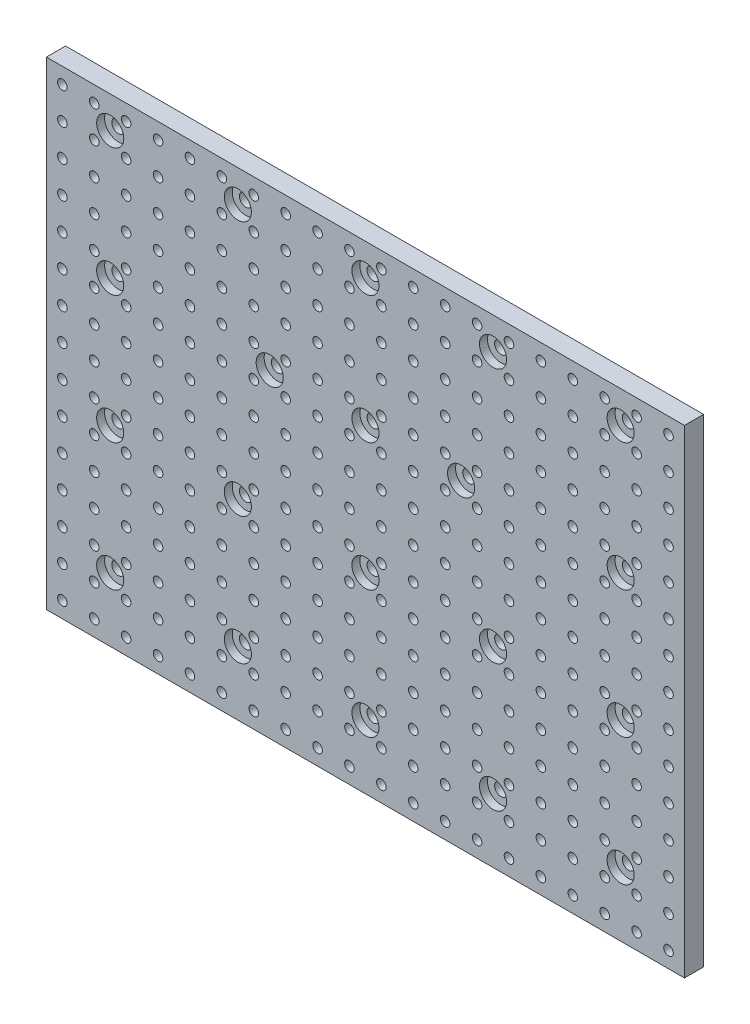
from build123d import *

# Parameters (mm, degrees)
SKETCH1_W           = 400
SKETCH1_H           = 300
BOSS_EXTRUDE1_DEPTH = 12
SKETCH5_R           = 3
CUT_EXTRUDE1_DEPTH  = 251.287834303
SKETCH6_R           = 4
CUT_EXTRUDE2_DEPTH  = 251.287834303
SKETCH7_R           = 8.5
CUT_EXTRUDE3_DEPTH  = 5


with BuildPart() as part:
    # Sketch1 → Boss-Extrude1 (new body)
    with BuildSketch(Plane.XY):
        Rectangle(SKETCH1_W, SKETCH1_H)
    extrude(amount=BOSS_EXTRUDE1_DEPTH)

    # Sketch5 → Cut-Extrude1 (cut, through all)
    with BuildSketch(Plane.XY.offset(12)):
        with Locations((-190, 140)):
            Circle(SKETCH5_R)
        with Locations((-170, 140)):
            Circle(SKETCH5_R)
        with Locations((-150, 140)):
            Circle(SKETCH5_R)
        with Locations((-130, 140)):
            Circle(SKETCH5_R)
        with Locations((-110, 140)):
            Circle(SKETCH5_R)
        with Locations((-90, 140)):
            Circle(SKETCH5_R)
        with Locations((-70, 140)):
            Circle(SKETCH5_R)
        with Locations((-50, 140)):
            Circle(SKETCH5_R)
        with Locations((-30, 140)):
            Circle(SKETCH5_R)
        with Locations((-10, 140)):
            Circle(SKETCH5_R)
        with Locations((10, 140)):
            Circle(SKETCH5_R)
        with Locations((30, 140)):
            Circle(SKETCH5_R)
        with Locations((50, 140)):
            Circle(SKETCH5_R)
        with Locations((70, 140)):
            Circle(SKETCH5_R)
        with Locations((90, 140)):
            Circle(SKETCH5_R)
        with Locations((110, 140)):
            Circle(SKETCH5_R)
        with Locations((130, 140)):
            Circle(SKETCH5_R)
        with Locations((150, 140)):
            Circle(SKETCH5_R)
        with Locations((170, 140)):
            Circle(SKETCH5_R)
        with Locations((190, 140)):
            Circle(SKETCH5_R)
        with Locations((-170, 120)):
            Circle(SKETCH5_R)
        with Locations((-150, 120)):
            Circle(SKETCH5_R)
        with Locations((-130, 120)):
            Circle(SKETCH5_R)
        with Locations((-110, 120)):
            Circle(SKETCH5_R)
        with Locations((-90, 120)):
            Circle(SKETCH5_R)
        with Locations((-70, 120)):
            Circle(SKETCH5_R)
        with Locations((-50, 120)):
            Circle(SKETCH5_R)
        with Locations((-30, 120)):
            Circle(SKETCH5_R)
        with Locations((-10, 120)):
            Circle(SKETCH5_R)
        with Locations((10, 120)):
            Circle(SKETCH5_R)
        with Locations((30, 120)):
            Circle(SKETCH5_R)
        with Locations((50, 120)):
            Circle(SKETCH5_R)
        with Locations((70, 120)):
            Circle(SKETCH5_R)
        with Locations((90, 120)):
            Circle(SKETCH5_R)
        with Locations((110, 120)):
            Circle(SKETCH5_R)
        with Locations((130, 120)):
            Circle(SKETCH5_R)
        with Locations((150, 120)):
            Circle(SKETCH5_R)
        with Locations((170, 120)):
            Circle(SKETCH5_R)
        with Locations((190, 120)):
            Circle(SKETCH5_R)
        with Locations((-170, 100)):
            Circle(SKETCH5_R)
        with Locations((-150, 100)):
            Circle(SKETCH5_R)
        with Locations((-130, 100)):
            Circle(SKETCH5_R)
        with Locations((-110, 100)):
            Circle(SKETCH5_R)
        with Locations((-90, 100)):
            Circle(SKETCH5_R)
        with Locations((-70, 100)):
            Circle(SKETCH5_R)
        with Locations((-50, 100)):
            Circle(SKETCH5_R)
        with Locations((-30, 100)):
            Circle(SKETCH5_R)
        with Locations((-10, 100)):
            Circle(SKETCH5_R)
        with Locations((10, 100)):
            Circle(SKETCH5_R)
        with Locations((30, 100)):
            Circle(SKETCH5_R)
        with Locations((50, 100)):
            Circle(SKETCH5_R)
        with Locations((70, 100)):
            Circle(SKETCH5_R)
        with Locations((90, 100)):
            Circle(SKETCH5_R)
        with Locations((110, 100)):
            Circle(SKETCH5_R)
        with Locations((130, 100)):
            Circle(SKETCH5_R)
        with Locations((150, 100)):
            Circle(SKETCH5_R)
        with Locations((170, 100)):
            Circle(SKETCH5_R)
        with Locations((190, 100)):
            Circle(SKETCH5_R)
        with Locations((-170, 80)):
            Circle(SKETCH5_R)
        with Locations((-150, 80)):
            Circle(SKETCH5_R)
        with Locations((-130, 80)):
            Circle(SKETCH5_R)
        with Locations((-110, 80)):
            Circle(SKETCH5_R)
        with Locations((-90, 80)):
            Circle(SKETCH5_R)
        with Locations((-70, 80)):
            Circle(SKETCH5_R)
        with Locations((-50, 80)):
            Circle(SKETCH5_R)
        with Locations((-30, 80)):
            Circle(SKETCH5_R)
        with Locations((-10, 80)):
            Circle(SKETCH5_R)
        with Locations((10, 80)):
            Circle(SKETCH5_R)
        with Locations((30, 80)):
            Circle(SKETCH5_R)
        with Locations((50, 80)):
            Circle(SKETCH5_R)
        with Locations((70, 80)):
            Circle(SKETCH5_R)
        with Locations((90, 80)):
            Circle(SKETCH5_R)
        with Locations((110, 80)):
            Circle(SKETCH5_R)
        with Locations((130, 80)):
            Circle(SKETCH5_R)
        with Locations((150, 80)):
            Circle(SKETCH5_R)
        with Locations((170, 80)):
            Circle(SKETCH5_R)
        with Locations((190, 80)):
            Circle(SKETCH5_R)
        with Locations((-170, 60)):
            Circle(SKETCH5_R)
        with Locations((-150, 60)):
            Circle(SKETCH5_R)
        with Locations((-130, 60)):
            Circle(SKETCH5_R)
        with Locations((-110, 60)):
            Circle(SKETCH5_R)
        with Locations((-90, 60)):
            Circle(SKETCH5_R)
        with Locations((-70, 60)):
            Circle(SKETCH5_R)
        with Locations((-50, 60)):
            Circle(SKETCH5_R)
        with Locations((-30, 60)):
            Circle(SKETCH5_R)
        with Locations((-10, 60)):
            Circle(SKETCH5_R)
        with Locations((10, 60)):
            Circle(SKETCH5_R)
        with Locations((30, 60)):
            Circle(SKETCH5_R)
        with Locations((50, 60)):
            Circle(SKETCH5_R)
        with Locations((70, 60)):
            Circle(SKETCH5_R)
        with Locations((90, 60)):
            Circle(SKETCH5_R)
        with Locations((110, 60)):
            Circle(SKETCH5_R)
        with Locations((130, 60)):
            Circle(SKETCH5_R)
        with Locations((150, 60)):
            Circle(SKETCH5_R)
        with Locations((170, 60)):
            Circle(SKETCH5_R)
        with Locations((190, 60)):
            Circle(SKETCH5_R)
        with Locations((-170, 40)):
            Circle(SKETCH5_R)
        with Locations((-150, 40)):
            Circle(SKETCH5_R)
        with Locations((-130, 40)):
            Circle(SKETCH5_R)
        with Locations((-110, 40)):
            Circle(SKETCH5_R)
        with Locations((-90, 40)):
            Circle(SKETCH5_R)
        with Locations((-70, 40)):
            Circle(SKETCH5_R)
        with Locations((-50, 40)):
            Circle(SKETCH5_R)
        with Locations((-30, 40)):
            Circle(SKETCH5_R)
        with Locations((-10, 40)):
            Circle(SKETCH5_R)
        with Locations((10, 40)):
            Circle(SKETCH5_R)
        with Locations((30, 40)):
            Circle(SKETCH5_R)
        with Locations((50, 40)):
            Circle(SKETCH5_R)
        with Locations((70, 40)):
            Circle(SKETCH5_R)
        with Locations((90, 40)):
            Circle(SKETCH5_R)
        with Locations((110, 40)):
            Circle(SKETCH5_R)
        with Locations((130, 40)):
            Circle(SKETCH5_R)
        with Locations((150, 40)):
            Circle(SKETCH5_R)
        with Locations((170, 40)):
            Circle(SKETCH5_R)
        with Locations((190, 40)):
            Circle(SKETCH5_R)
        with Locations((-170, 20)):
            Circle(SKETCH5_R)
        with Locations((-150, 20)):
            Circle(SKETCH5_R)
        with Locations((-130, 20)):
            Circle(SKETCH5_R)
        with Locations((-110, 20)):
            Circle(SKETCH5_R)
        with Locations((-90, 20)):
            Circle(SKETCH5_R)
        with Locations((-70, 20)):
            Circle(SKETCH5_R)
        with Locations((-50, 20)):
            Circle(SKETCH5_R)
        with Locations((-30, 20)):
            Circle(SKETCH5_R)
        with Locations((-10, 20)):
            Circle(SKETCH5_R)
        with Locations((10, 20)):
            Circle(SKETCH5_R)
        with Locations((30, 20)):
            Circle(SKETCH5_R)
        with Locations((50, 20)):
            Circle(SKETCH5_R)
        with Locations((70, 20)):
            Circle(SKETCH5_R)
        with Locations((90, 20)):
            Circle(SKETCH5_R)
        with Locations((110, 20)):
            Circle(SKETCH5_R)
        with Locations((130, 20)):
            Circle(SKETCH5_R)
        with Locations((150, 20)):
            Circle(SKETCH5_R)
        with Locations((170, 20)):
            Circle(SKETCH5_R)
        with Locations((190, 20)):
            Circle(SKETCH5_R)
        with Locations((-170, 0)):
            Circle(SKETCH5_R)
        with Locations((-150, 0)):
            Circle(SKETCH5_R)
        with Locations((-130, 0)):
            Circle(SKETCH5_R)
        with Locations((-110, 0)):
            Circle(SKETCH5_R)
        with Locations((-90, 0)):
            Circle(SKETCH5_R)
        with Locations((-70, 0)):
            Circle(SKETCH5_R)
        with Locations((-50, 0)):
            Circle(SKETCH5_R)
        with Locations((-30, 0)):
            Circle(SKETCH5_R)
        with Locations((-10, 0)):
            Circle(SKETCH5_R)
        with Locations((10, 0)):
            Circle(SKETCH5_R)
        with Locations((30, 0)):
            Circle(SKETCH5_R)
        with Locations((50, 0)):
            Circle(SKETCH5_R)
        with Locations((70, 0)):
            Circle(SKETCH5_R)
        with Locations((90, 0)):
            Circle(SKETCH5_R)
        with Locations((110, 0)):
            Circle(SKETCH5_R)
        with Locations((130, 0)):
            Circle(SKETCH5_R)
        with Locations((150, 0)):
            Circle(SKETCH5_R)
        with Locations((170, 0)):
            Circle(SKETCH5_R)
        with Locations((190, 0)):
            Circle(SKETCH5_R)
        with Locations((-170, -20)):
            Circle(SKETCH5_R)
        with Locations((-150, -20)):
            Circle(SKETCH5_R)
        with Locations((-130, -20)):
            Circle(SKETCH5_R)
        with Locations((-110, -20)):
            Circle(SKETCH5_R)
        with Locations((-90, -20)):
            Circle(SKETCH5_R)
        with Locations((-70, -20)):
            Circle(SKETCH5_R)
        with Locations((-50, -20)):
            Circle(SKETCH5_R)
        with Locations((-30, -20)):
            Circle(SKETCH5_R)
        with Locations((-10, -20)):
            Circle(SKETCH5_R)
        with Locations((10, -20)):
            Circle(SKETCH5_R)
        with Locations((30, -20)):
            Circle(SKETCH5_R)
        with Locations((50, -20)):
            Circle(SKETCH5_R)
        with Locations((70, -20)):
            Circle(SKETCH5_R)
        with Locations((90, -20)):
            Circle(SKETCH5_R)
        with Locations((110, -20)):
            Circle(SKETCH5_R)
        with Locations((130, -20)):
            Circle(SKETCH5_R)
        with Locations((150, -20)):
            Circle(SKETCH5_R)
        with Locations((170, -20)):
            Circle(SKETCH5_R)
        with Locations((190, -20)):
            Circle(SKETCH5_R)
        with Locations((-170, -40)):
            Circle(SKETCH5_R)
        with Locations((-150, -40)):
            Circle(SKETCH5_R)
        with Locations((-130, -40)):
            Circle(SKETCH5_R)
        with Locations((-110, -40)):
            Circle(SKETCH5_R)
        with Locations((-90, -40)):
            Circle(SKETCH5_R)
        with Locations((-70, -40)):
            Circle(SKETCH5_R)
        with Locations((-50, -40)):
            Circle(SKETCH5_R)
        with Locations((-30, -40)):
            Circle(SKETCH5_R)
        with Locations((-10, -40)):
            Circle(SKETCH5_R)
        with Locations((10, -40)):
            Circle(SKETCH5_R)
        with Locations((30, -40)):
            Circle(SKETCH5_R)
        with Locations((50, -40)):
            Circle(SKETCH5_R)
        with Locations((70, -40)):
            Circle(SKETCH5_R)
        with Locations((90, -40)):
            Circle(SKETCH5_R)
        with Locations((110, -40)):
            Circle(SKETCH5_R)
        with Locations((130, -40)):
            Circle(SKETCH5_R)
        with Locations((150, -40)):
            Circle(SKETCH5_R)
        with Locations((170, -40)):
            Circle(SKETCH5_R)
        with Locations((190, -40)):
            Circle(SKETCH5_R)
        with Locations((-170, -60)):
            Circle(SKETCH5_R)
        with Locations((-150, -60)):
            Circle(SKETCH5_R)
        with Locations((-130, -60)):
            Circle(SKETCH5_R)
        with Locations((-110, -60)):
            Circle(SKETCH5_R)
        with Locations((-90, -60)):
            Circle(SKETCH5_R)
        with Locations((-70, -60)):
            Circle(SKETCH5_R)
        with Locations((-50, -60)):
            Circle(SKETCH5_R)
        with Locations((-30, -60)):
            Circle(SKETCH5_R)
        with Locations((-10, -60)):
            Circle(SKETCH5_R)
        with Locations((10, -60)):
            Circle(SKETCH5_R)
        with Locations((30, -60)):
            Circle(SKETCH5_R)
        with Locations((50, -60)):
            Circle(SKETCH5_R)
        with Locations((70, -60)):
            Circle(SKETCH5_R)
        with Locations((90, -60)):
            Circle(SKETCH5_R)
        with Locations((110, -60)):
            Circle(SKETCH5_R)
        with Locations((130, -60)):
            Circle(SKETCH5_R)
        with Locations((150, -60)):
            Circle(SKETCH5_R)
        with Locations((170, -60)):
            Circle(SKETCH5_R)
        with Locations((190, -60)):
            Circle(SKETCH5_R)
        with Locations((-170, -80)):
            Circle(SKETCH5_R)
        with Locations((-150, -80)):
            Circle(SKETCH5_R)
        with Locations((-130, -80)):
            Circle(SKETCH5_R)
        with Locations((-110, -80)):
            Circle(SKETCH5_R)
        with Locations((-90, -80)):
            Circle(SKETCH5_R)
        with Locations((-70, -80)):
            Circle(SKETCH5_R)
        with Locations((-50, -80)):
            Circle(SKETCH5_R)
        with Locations((-30, -80)):
            Circle(SKETCH5_R)
        with Locations((-10, -80)):
            Circle(SKETCH5_R)
        with Locations((10, -80)):
            Circle(SKETCH5_R)
        with Locations((30, -80)):
            Circle(SKETCH5_R)
        with Locations((50, -80)):
            Circle(SKETCH5_R)
        with Locations((70, -80)):
            Circle(SKETCH5_R)
        with Locations((90, -80)):
            Circle(SKETCH5_R)
        with Locations((110, -80)):
            Circle(SKETCH5_R)
        with Locations((130, -80)):
            Circle(SKETCH5_R)
        with Locations((150, -80)):
            Circle(SKETCH5_R)
        with Locations((170, -80)):
            Circle(SKETCH5_R)
        with Locations((190, -80)):
            Circle(SKETCH5_R)
        with Locations((-170, -100)):
            Circle(SKETCH5_R)
        with Locations((-150, -100)):
            Circle(SKETCH5_R)
        with Locations((-130, -100)):
            Circle(SKETCH5_R)
        with Locations((-110, -100)):
            Circle(SKETCH5_R)
        with Locations((-90, -100)):
            Circle(SKETCH5_R)
        with Locations((-70, -100)):
            Circle(SKETCH5_R)
        with Locations((-50, -100)):
            Circle(SKETCH5_R)
        with Locations((-30, -100)):
            Circle(SKETCH5_R)
        with Locations((-10, -100)):
            Circle(SKETCH5_R)
        with Locations((10, -100)):
            Circle(SKETCH5_R)
        with Locations((30, -100)):
            Circle(SKETCH5_R)
        with Locations((50, -100)):
            Circle(SKETCH5_R)
        with Locations((70, -100)):
            Circle(SKETCH5_R)
        with Locations((90, -100)):
            Circle(SKETCH5_R)
        with Locations((110, -100)):
            Circle(SKETCH5_R)
        with Locations((130, -100)):
            Circle(SKETCH5_R)
        with Locations((150, -100)):
            Circle(SKETCH5_R)
        with Locations((170, -100)):
            Circle(SKETCH5_R)
        with Locations((190, -100)):
            Circle(SKETCH5_R)
        with Locations((-170, -120)):
            Circle(SKETCH5_R)
        with Locations((-150, -120)):
            Circle(SKETCH5_R)
        with Locations((-130, -120)):
            Circle(SKETCH5_R)
        with Locations((-110, -120)):
            Circle(SKETCH5_R)
        with Locations((-90, -120)):
            Circle(SKETCH5_R)
        with Locations((-70, -120)):
            Circle(SKETCH5_R)
        with Locations((-50, -120)):
            Circle(SKETCH5_R)
        with Locations((-30, -120)):
            Circle(SKETCH5_R)
        with Locations((-10, -120)):
            Circle(SKETCH5_R)
        with Locations((10, -120)):
            Circle(SKETCH5_R)
        with Locations((30, -120)):
            Circle(SKETCH5_R)
        with Locations((50, -120)):
            Circle(SKETCH5_R)
        with Locations((70, -120)):
            Circle(SKETCH5_R)
        with Locations((90, -120)):
            Circle(SKETCH5_R)
        with Locations((110, -120)):
            Circle(SKETCH5_R)
        with Locations((130, -120)):
            Circle(SKETCH5_R)
        with Locations((150, -120)):
            Circle(SKETCH5_R)
        with Locations((170, -120)):
            Circle(SKETCH5_R)
        with Locations((190, -120)):
            Circle(SKETCH5_R)
        with Locations((-170, -140)):
            Circle(SKETCH5_R)
        with Locations((-150, -140)):
            Circle(SKETCH5_R)
        with Locations((-130, -140)):
            Circle(SKETCH5_R)
        with Locations((-110, -140)):
            Circle(SKETCH5_R)
        with Locations((-90, -140)):
            Circle(SKETCH5_R)
        with Locations((-70, -140)):
            Circle(SKETCH5_R)
        with Locations((-50, -140)):
            Circle(SKETCH5_R)
        with Locations((-30, -140)):
            Circle(SKETCH5_R)
        with Locations((-10, -140)):
            Circle(SKETCH5_R)
        with Locations((10, -140)):
            Circle(SKETCH5_R)
        with Locations((30, -140)):
            Circle(SKETCH5_R)
        with Locations((50, -140)):
            Circle(SKETCH5_R)
        with Locations((70, -140)):
            Circle(SKETCH5_R)
        with Locations((90, -140)):
            Circle(SKETCH5_R)
        with Locations((110, -140)):
            Circle(SKETCH5_R)
        with Locations((130, -140)):
            Circle(SKETCH5_R)
        with Locations((150, -140)):
            Circle(SKETCH5_R)
        with Locations((170, -140)):
            Circle(SKETCH5_R)
        with Locations((190, -140)):
            Circle(SKETCH5_R)
        with Locations((-190, 120)):
            Circle(SKETCH5_R)
        with Locations((-190, 100)):
            Circle(SKETCH5_R)
        with Locations((-190, 80)):
            Circle(SKETCH5_R)
        with Locations((-190, 60)):
            Circle(SKETCH5_R)
        with Locations((-190, 40)):
            Circle(SKETCH5_R)
        with Locations((-190, 20)):
            Circle(SKETCH5_R)
        with Locations((-190, 0)):
            Circle(SKETCH5_R)
        with Locations((-190, -20)):
            Circle(SKETCH5_R)
        with Locations((-190, -40)):
            Circle(SKETCH5_R)
        with Locations((-190, -60)):
            Circle(SKETCH5_R)
        with Locations((-190, -80)):
            Circle(SKETCH5_R)
        with Locations((-190, -100)):
            Circle(SKETCH5_R)
        with Locations((-190, -120)):
            Circle(SKETCH5_R)
        with Locations((-190, -140)):
            Circle(SKETCH5_R)
    extrude(amount=-CUT_EXTRUDE1_DEPTH, mode=Mode.SUBTRACT)

    # Sketch6 → Cut-Extrude2 (cut, through all)
    with BuildSketch(Plane.XY.offset(12)):
        with Locations((-160, 130)):
            Circle(SKETCH6_R)
        with Locations((-80, 130)):
            Circle(SKETCH6_R)
        with Locations((0, 130)):
            Circle(SKETCH6_R)
        with Locations((80, 130)):
            Circle(SKETCH6_R)
        with Locations((160, 130)):
            Circle(SKETCH6_R)
        with Locations((-160, 50)):
            Circle(SKETCH6_R)
        with Locations((0, 50)):
            Circle(SKETCH6_R)
        with Locations((160, 50)):
            Circle(SKETCH6_R)
        with Locations((-160, -30)):
            Circle(SKETCH6_R)
        with Locations((-80, -30)):
            Circle(SKETCH6_R)
        with Locations((0, -30)):
            Circle(SKETCH6_R)
        with Locations((80, -30)):
            Circle(SKETCH6_R)
        with Locations((160, -30)):
            Circle(SKETCH6_R)
        with Locations((-160, -110)):
            Circle(SKETCH6_R)
        with Locations((-80, -110)):
            Circle(SKETCH6_R)
        with Locations((0, -110)):
            Circle(SKETCH6_R)
        with Locations((80, -110)):
            Circle(SKETCH6_R)
        with Locations((160, -110)):
            Circle(SKETCH6_R)
        with Locations((-60, 50)):
            Circle(SKETCH6_R)
        with Locations((60, 50)):
            Circle(SKETCH6_R)
    extrude(amount=-CUT_EXTRUDE2_DEPTH, mode=Mode.SUBTRACT)

    # Sketch7 → Cut-Extrude3 (cut)
    with BuildSketch(Plane.XY.offset(12)):
        with Locations((-160, 130)):
            Circle(SKETCH7_R)
        with Locations((-80, 130)):
            Circle(SKETCH7_R)
        with Locations((0, 130)):
            Circle(SKETCH7_R)
        with Locations((80, 130)):
            Circle(SKETCH7_R)
        with Locations((160, 130)):
            Circle(SKETCH7_R)
        with Locations((-160, 50)):
            Circle(SKETCH7_R)
        with Locations((-60, 50)):
            Circle(SKETCH7_R)
        with Locations((0, 50)):
            Circle(SKETCH7_R)
        with Locations((60, 50)):
            Circle(SKETCH7_R)
        with Locations((160, 50)):
            Circle(SKETCH7_R)
        with Locations((-160, -30)):
            Circle(SKETCH7_R)
        with Locations((-80, -30)):
            Circle(SKETCH7_R)
        with Locations((0, -30)):
            Circle(SKETCH7_R)
        with Locations((80, -30)):
            Circle(SKETCH7_R)
        with Locations((160, -30)):
            Circle(SKETCH7_R)
        with Locations((-160, -110)):
            Circle(SKETCH7_R)
        with Locations((-80, -110)):
            Circle(SKETCH7_R)
        with Locations((0, -110)):
            Circle(SKETCH7_R)
        with Locations((80, -110)):
            Circle(SKETCH7_R)
        with Locations((160, -110)):
            Circle(SKETCH7_R)
    extrude(amount=-CUT_EXTRUDE3_DEPTH, mode=Mode.SUBTRACT)


solid = part.part
